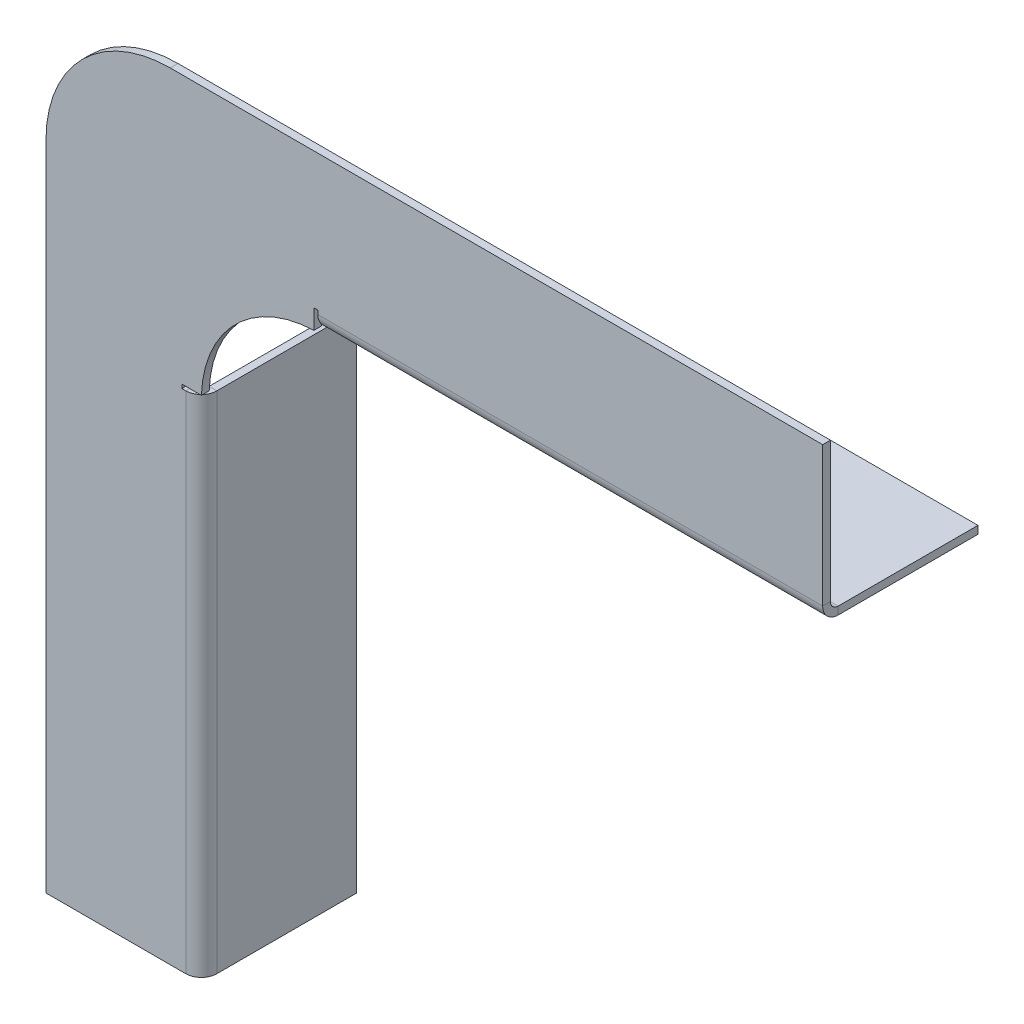
from build123d import *

# Parameters (mm, degrees)
BASE_FLANGE1_DEPTH              = 1
EDGE_FLANGE1_STRIP_W            = 6
EDGE_FLANGE1_STRIP_H            = 1
EDGE_FLANGE1_STRIP_CUT_DEPTH    = 65
EDGE_FLANGE1_RELIEF_W           = 6.5
EDGE_FLANGE1_RELIEF_H           = 0.5
EDGE_FLANGE1_RELIEF_CUT_DEPTH   = 1
EDGE_FLANGE1_STRIP_2_W          = 6
EDGE_FLANGE1_STRIP_2_H          = 1
EDGE_FLANGE1_STRIP_CUT_2_DEPTH  = 65
EDGE_FLANGE1_RELIEF_2_W         = 6.5
EDGE_FLANGE1_RELIEF_2_H         = 0.5
EDGE_FLANGE1_RELIEF_CUT_2_DEPTH = 1
EDGE_FLANGE1_DEPTH              = 65
EDGE_FLANGE1_BEND_DEPTH         = 65


# Sheet-metal steps are written as plain solids
with BuildPart() as part:
    # Sketch1 → Base-Flange1 (new body)
    with BuildSketch(Plane.XY):
        with BuildLine():
            Line((-16, 0), (-16, -84))
            Line((-16, -84), (4, -84))
            Line((4, -84), (4, -19))
            ThreePointArc((4, -19), (8.393398282, -8.393398282), (19, -4))
            Line((19, -4), (84, -4))
            Line((84, -4), (84, 16))
            Line((84, 16), (0, 16))
            ThreePointArc((0, 16), (-11.313708499, 11.313708499), (-16, 0))
        make_face()
    extrude(amount=-BASE_FLANGE1_DEPTH)

    # Edge-Flange1 strip (across the edge) → Edge-Flange1 strip cut (cut)
    with BuildSketch(Plane(origin=(84, -4, -1), x_dir=(0, 1, 0), z_dir=(-1, 0, 0))):
        with Locations((-1, -0.5)):
            Rectangle(EDGE_FLANGE1_STRIP_W, EDGE_FLANGE1_STRIP_H)
    extrude(amount=EDGE_FLANGE1_STRIP_CUT_DEPTH, mode=Mode.SUBTRACT)

    # Edge-Flange1 relief (on the sheet) → Edge-Flange1 relief cut (cut)
    with BuildSketch(Plane(origin=(84, -2, -1), x_dir=(0, 1, 0), z_dir=(0, 0, -1))):
        with Locations((-2.75, -65.25)):
            Rectangle(EDGE_FLANGE1_RELIEF_W, EDGE_FLANGE1_RELIEF_H)
    extrude(amount=-EDGE_FLANGE1_RELIEF_CUT_DEPTH, mode=Mode.SUBTRACT)

    # Edge-Flange1 strip 2 (across the edge) → Edge-Flange1 strip cut 2 (cut)
    with BuildSketch(Plane(origin=(4, -19, -1), x_dir=(-1, 0, 0), z_dir=(0, -1, 0))):
        with Locations((-1, -0.5)):
            Rectangle(EDGE_FLANGE1_STRIP_2_W, EDGE_FLANGE1_STRIP_2_H)
    extrude(amount=EDGE_FLANGE1_STRIP_CUT_2_DEPTH, mode=Mode.SUBTRACT)

    # Edge-Flange1 relief 2 (on the sheet) → Edge-Flange1 relief cut 2 (cut)
    with BuildSketch(Plane(origin=(2, -19, -1), x_dir=(-1, 0, 0), z_dir=(0, 0, -1))):
        with Locations((-2.75, 0.25)):
            Rectangle(EDGE_FLANGE1_RELIEF_2_W, EDGE_FLANGE1_RELIEF_2_H)
    extrude(amount=-EDGE_FLANGE1_RELIEF_CUT_2_DEPTH, mode=Mode.SUBTRACT)

    # Edge-Flange1 section (across the edge) → Edge-Flange1 (add)
    with BuildSketch(Plane(origin=(84, -4, -1), x_dir=(0, 1, 0), z_dir=(-1, 0, 0))):
        with BuildLine():
            Line((0, 1), (0, 19))
            Line((0, 19), (1, 19))
            Line((1, 19), (1, 1))
            ThreePointArc((1, 1), (1.292893219, 0.292893219), (2, 0))
            Line((2, 0), (2, -1))
            ThreePointArc((2, -1), (0.585786438, -0.414213562), (0, 1))
        make_face()
    extrude(amount=EDGE_FLANGE1_DEPTH)

    # Edge-Flange1 section 2 (across the edge) → Edge-Flange1 bend (add)
    with BuildSketch(Plane(origin=(4, -19, -1), x_dir=(-1, 0, 0), z_dir=(0, -1, 0))):
        with BuildLine():
            Line((0, 1), (0, 19))
            Line((0, 19), (1, 19))
            Line((1, 19), (1, 1))
            ThreePointArc((1, 1), (1.292893219, 0.292893219), (2, 0))
            Line((2, 0), (2, -1))
            ThreePointArc((2, -1), (0.585786438, -0.414213562), (0, 1))
        make_face()
    extrude(amount=EDGE_FLANGE1_BEND_DEPTH)


solid = part.part
